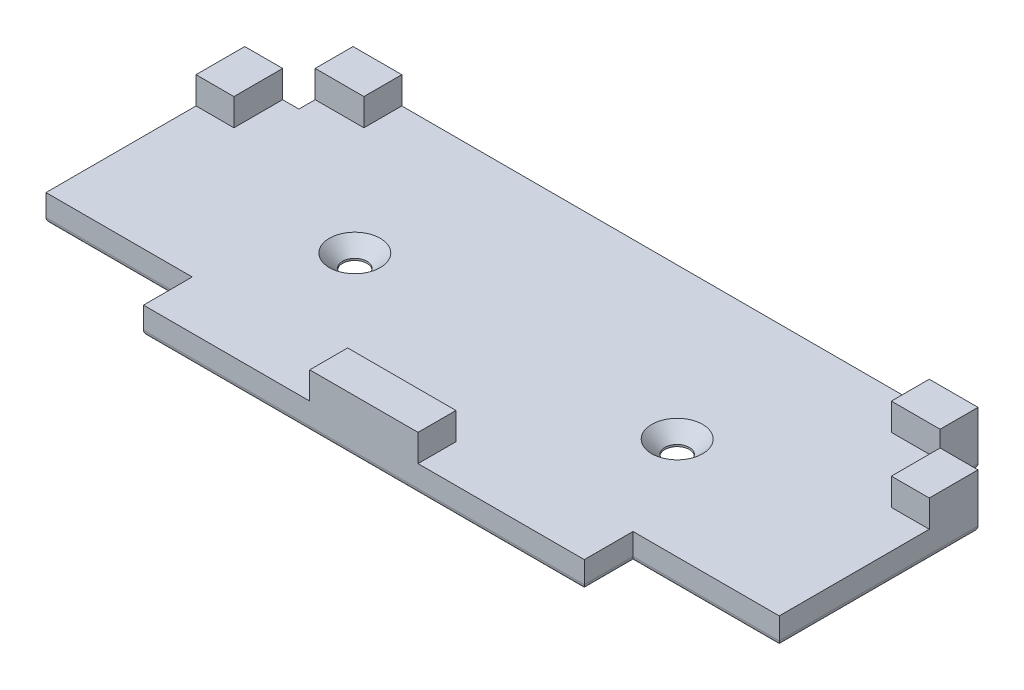
from build123d import *

# Parameters (mm, degrees)
SKETCH1_W                                     = 135.4
SKETCH1_H                                     = 55.7
BOSS_EXTRUDE1_DEPTH                           = 5
SKETCH2_W                                     = 20
SKETCH2_H                                     = 7
BOSS_EXTRUDE2_DEPTH                           = 5
SKETCH3_W                                     = 27
SKETCH3_H                                     = 9
CUT_EXTRUDE1_DEPTH                            = 74.375149063
CSK_FOR_M4_COUNTERSUNK_FLAT_HEAD1_D           = 4.5
CSK_FOR_M4_COUNTERSUNK_FLAT_HEAD1_CSINK_D     = 9.4
CSK_FOR_M4_COUNTERSUNK_FLAT_HEAD1_CSINK_ANGLE = 90
SKETCH7_W                                     = 30
SKETCH7_H                                     = 30
CUT_EXTRUDE2_DEPTH                            = 2.2
SKETCH9_W                                     = 10
SKETCH9_H                                     = 10
CUT_EXTRUDE5_DEPTH                            = 74.88445371
FILLET1_R                                     = 1


with BuildPart() as part:
    # Sketch1 → Boss-Extrude1 (new body)
    with BuildSketch(Plane(origin=(0, 0, 0), x_dir=(1, 0, 0), z_dir=(0, 1, 0))):
        Rectangle(SKETCH1_W, SKETCH1_H)
    extrude(amount=BOSS_EXTRUDE1_DEPTH)

    # Sketch2 → Boss-Extrude2 (add)
    with BuildSketch(Plane(origin=(0, 5, 0), x_dir=(1, 0, 0), z_dir=(0, 1, 0))):
        Polygon((-60.7, 20.85), (-48.7, 20.85), (-48.7, 27.85), (-67.7, 27.85), (-67.7, 8.85), (-60.7, 8.85), align=None)
        Polygon((67.7, 27.85), (48.7, 27.85), (48.7, 20.85), (60.7, 20.85), (60.7, 8.85), (67.7, 8.85), align=None)
        with Locations((0, -24.35)):
            Rectangle(SKETCH2_W, SKETCH2_H)
    extrude(amount=BOSS_EXTRUDE2_DEPTH)

    # Sketch3 → Cut-Extrude1 (cut, through all)
    with BuildSketch(Plane(origin=(0, 5, 0), x_dir=(1, 0, 0), z_dir=(0, 1, 0))):
        with Locations((-54.2, -23.35)):
            Rectangle(SKETCH3_W, SKETCH3_H)
    cut_extrude1 = extrude(amount=-CUT_EXTRUDE1_DEPTH, mode=Mode.SUBTRACT)

    # Mirror1: Cut-Extrude1 across plane
    add(cut_extrude1.mirror(Plane(origin=(0, 0, 0), x_dir=(0, 0, 1), z_dir=(1, 0, 0))), mode=Mode.SUBTRACT)

    # CSK for M4 Countersunk Flat Head1 (through all)
    with Locations(Plane(origin=(-29.527844293, 5, 0), x_dir=(0, 0, 1), z_dir=(0, 1, 0))):
        with Locations((0, 0), (0, 59.527844293)):
            CounterSinkHole(CSK_FOR_M4_COUNTERSUNK_FLAT_HEAD1_D / 2, CSK_FOR_M4_COUNTERSUNK_FLAT_HEAD1_CSINK_D / 2, counter_sink_angle=CSK_FOR_M4_COUNTERSUNK_FLAT_HEAD1_CSINK_ANGLE)

    # Sketch7 → Cut-Extrude2 (cut)
    with BuildSketch(Plane.XZ):
        with Locations((-30, 0)):
            Rectangle(SKETCH7_W, SKETCH7_H)
        with Locations((30, 0)):
            Rectangle(SKETCH7_W, SKETCH7_H)
    extrude(amount=-CUT_EXTRUDE2_DEPTH, mode=Mode.SUBTRACT)

    # Sketch9 → Cut-Extrude5 (cut, through all)
    with BuildSketch(Plane(origin=(0, 10, 0), x_dir=(1, 0, 0), z_dir=(0, 1, 0))):
        with Locations((62.7, 22.85)):
            Rectangle(SKETCH9_W, SKETCH9_H)
    cut_extrude5 = extrude(amount=-CUT_EXTRUDE5_DEPTH, mode=Mode.SUBTRACT)

    # Mirror2: Cut-Extrude5 across plane
    add(cut_extrude5.mirror(Plane(origin=(0, 0, 0), x_dir=(0, 0, 1), z_dir=(1, 0, 0))), mode=Mode.SUBTRACT)

    # Fillet1
    fillet1_edges = [part.edges().sort_by_distance(p)[0] for p in [
        (-57.7, 0, -22.85),
        (-62.7, 0, -17.85),
        (-67.7, 0, 0.5),
        (-54.2, 0, 18.85),
        (-40.7, 0, 23.35),
        (40.7, 0, 23.35),
        (0, 0, 27.85),
        (0, 0, -27.85),
        (57.7, 0, -22.85),
        (62.7, 0, -17.85),
        (54.2, 0, 18.85),
        (67.7, 0, 0.5),
    ]]
    fillet(fillet1_edges, radius=FILLET1_R)


solid = part.part
